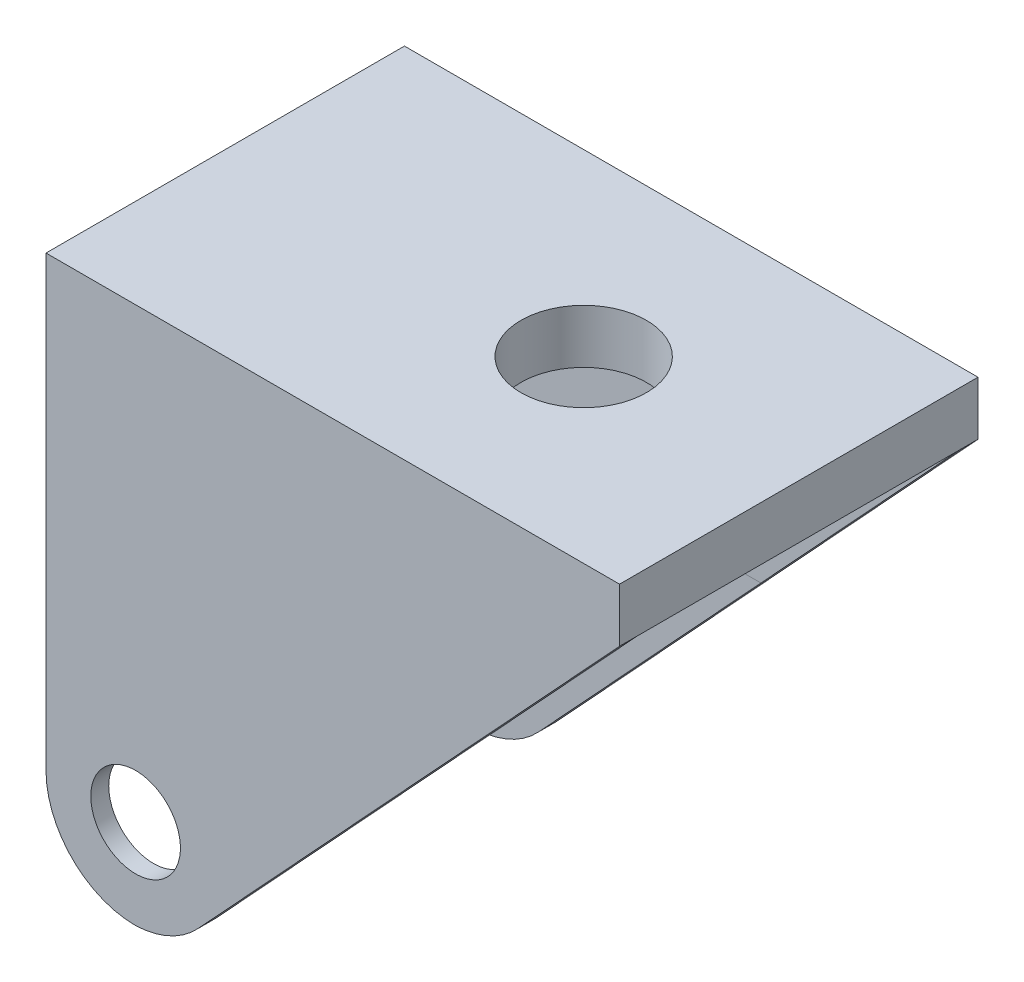
from build123d import *

# Parameters (mm, degrees)
SKETCH4_W               = 20
SKETCH4_H               = 30
BOSS_EXTRUDE2_DEPTH     = 16
CUT_EXTRUDE2_DEPTH      = 37.728735344
CUT_EXTRUDE2_DEPTH_BACK = 32
CUT_EXTRUDE4_DEPTH      = 30.681644159
CUT_EXTRUDE4_DEPTH_BACK = 30.681644159
SKETCH7_R               = 2.5
CUT_EXTRUDE5_DEPTH      = 30.681644159
FILLET2_R               = 5
FILLET3_R               = 5
FILLET4_R               = 5
FILLET5_R               = 5
CUT_EXTRUDE6_REACH      = 37.44
SKETCH8_R               = 3.5


with BuildPart() as part:
    # Sketch4 → Boss-Extrude2 (new, symmetric)
    with BuildSketch(Plane(origin=(0, 0, 0), x_dir=(0, 0, -1), z_dir=(1, 0, 0))):
        Rectangle(SKETCH4_W, SKETCH4_H)
    extrude(amount=BOSS_EXTRUDE2_DEPTH, both=True)

    # Sketch5 → Cut-Extrude2 (cut, two sides: drawn at the far end of the back side and taken through both)
    with BuildSketch(Plane.ZY.offset(16).offset(-CUT_EXTRUDE2_DEPTH_BACK)):
        Polygon((-9, -96.021123618), (-9, -15), (-9, 0), (-9, 12), (9, 12), (9, 0), (9, -15), (9, -96.021123618), (9, -258.063370855), (-9, -258.063370855), align=None)
    extrude(amount=CUT_EXTRUDE2_DEPTH + CUT_EXTRUDE2_DEPTH_BACK, mode=Mode.SUBTRACT)

    # Sketch6 → Cut-Extrude4 (cut, two sides: drawn at the far end of the back side and taken through both)
    with BuildSketch(Plane(origin=(0, 0, -10), x_dir=(-1, 0, 0), z_dir=(0, 0, -1)).offset(-CUT_EXTRUDE4_DEPTH_BACK)):
        Polygon((-79.686136493, 80.781027412), (-16, 12), (9, -15), (72.686136493, -83.781027412), (-64.875918332, -211.153300398), (-217.248191317, -46.591245573), align=None)
    extrude(amount=CUT_EXTRUDE4_DEPTH + CUT_EXTRUDE4_DEPTH_BACK, mode=Mode.SUBTRACT)

    # Sketch7 → Cut-Extrude5 (cut, through all)
    with BuildSketch(Plane(origin=(0, 0, -10), x_dir=(-1, 0, 0), z_dir=(0, 0, -1))):
        with Locations((11, -10)):
            Circle(SKETCH7_R)
    extrude(amount=-CUT_EXTRUDE5_DEPTH, mode=Mode.SUBTRACT)

    # Fillet2
    fillet2_edges = [part.edges().sort_by_distance(p)[0] for p in [
        (-16, -15, -9.5),
    ]]
    fillet(fillet2_edges, radius=FILLET2_R)

    # Fillet3
    # the kernel refuses this fillet: 5 mm, written as the material it takes off along each edge
    with BuildSketch(Plane(origin=(-9, -15, -15.449426147), x_dir=(-1, 0, 0), z_dir=(0, 0, 1))) as fillet3_piece_1:
        with BuildLine():
            CenterArc((2.187849813, -4.996469999), FILLET3_R, 92.15310702, 45.049491141)
            Line((-1.480953557, -1.599429841), (-1.554329624, -1.531489038))
            Line((-1.554329624, -1.531489038), (-0.073376067, 0.067940803))
            Line((-0.073376067, 0.067940803), (0, 0.1))
            ThreePointArc((0, 0.1), (1, 0.1), (1.996243004, 0.0999294))
            Line((1.996243004, 0.0999294), (2, 0))
        make_face()
    extrude(amount=11.898852295, mode=Mode.SUBTRACT)

    # Fillet4
    fillet4_edges = [part.edges().sort_by_distance(p)[0] for p in [
        (-16, -15, 9.5),
    ]]
    fillet(fillet4_edges, radius=FILLET4_R)

    # Fillet5
    # the kernel refuses this fillet: 5 mm, written as the material it takes off along each edge
    with BuildSketch(Plane(origin=(-9, -15, 3.550573853), x_dir=(-1, 0, 0), z_dir=(0, 0, 1))) as fillet5_piece_1:
        with BuildLine():
            CenterArc((2.187849813, -4.996469999), FILLET5_R, 92.15310702, 45.049491141)
            Line((-1.480953557, -1.599429841), (-1.554329624, -1.531489038))
            Line((-1.554329624, -1.531489038), (-0.073376067, 0.067940803))
            Line((-0.073376067, 0.067940803), (0, 0.1))
            ThreePointArc((0, 0.1), (1, 0.1), (1.996243004, 0.0999294))
            Line((1.996243004, 0.0999294), (2, 0))
        make_face()
    extrude(amount=11.898852295, mode=Mode.SUBTRACT)

    # Sketch8 → Cut-Extrude6 (cut, up to next)
    with BuildSketch(Plane(origin=(0, 15, 0), x_dir=(1, 0, 0), z_dir=(0, 1, 0)), mode=Mode.PRIVATE) as cut_extrude6_sk1:
        with Locations(Location((4, 0, 0), (0, 0, 270))):
            Circle(SKETCH8_R)
    cut_extrude6_tool1 = extrude(cut_extrude6_sk1.sketch, amount=-CUT_EXTRUDE6_REACH, mode=Mode.PRIVATE) & part.part
    add(cut_extrude6_tool1.solids().sort_by_distance((4, 15, 0))[0], mode=Mode.SUBTRACT)


solid = part.part
